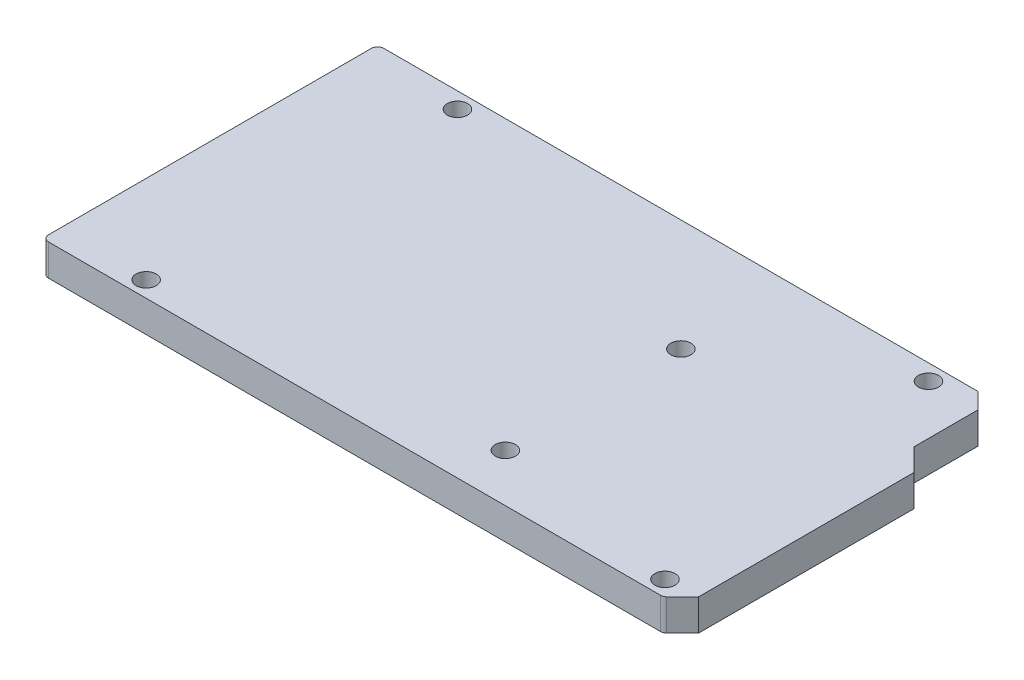
from build123d import *

# Parameters (mm, degrees)
BOSS_EXTRUDE1_DEPTH = 5
SKETCH2_R           = 1.608
CUT_EXTRUDE1_DEPTH  = 58.548241502
FILLET1_R           = 0.994


with BuildPart() as part:
    # Sketch1 → Boss-Extrude1 (new body)
    with BuildSketch(Plane(origin=(0, 0, 0), x_dir=(1, 0, 0), z_dir=(0, 1, 0))):
        Polygon((-50.76, -26.65), (-50.76, 26.65), (44.689, 26.65), (47.228, 24.111), (47.228, 13.955), (50.76, 10.423), (50.76, -23.834), (48.221, -26.373), (48.221, -26.65), align=None)
    extrude(amount=BOSS_EXTRUDE1_DEPTH)

    # Sketch2 → Cut-Extrude1 (cut, through all)
    with BuildSketch(Plane(origin=(0, 0, 0), x_dir=(1, 0, 0), z_dir=(0, 1, 0))):
        with Locations(Location((-35.525, 24.111, 0), (0, 0, 270))):
            Circle(SKETCH2_R)
        with Locations(Location((-36.795, -24.111, 0), (0, 0, 270))):
            Circle(SKETCH2_R)
        with Locations(Location((15.235, 8.876, 0), (0, 0, 270))):
            Circle(SKETCH2_R)
        with Locations(Location((15.235, -19.033, 0), (0, 0, 270))):
            Circle(SKETCH2_R)
        with Locations(Location((39.357, 24.111, 0), (0, 0, 270))):
            Circle(SKETCH2_R)
        with Locations(Location((45.684, -24.111, 0), (0, 0, 270))):
            Circle(SKETCH2_R)
    extrude(amount=CUT_EXTRUDE1_DEPTH, mode=Mode.SUBTRACT)

    # Fillet1
    # the kernel refuses this fillet: 0.994 mm, written as the material it takes off along each edge
    with BuildSketch(Plane(origin=(48.221, -1.721095218, 26.65), x_dir=(-1, 0, 0), z_dir=(0, 1, 0))) as fillet1_piece_1:
        with BuildLine():
            CenterArc((0.688438087, -0.994), FILLET1_R, 90, 43.83577097)
            Line((0, -0.277), (-0.013768762, -0.26266))
            ThreePointArc((-0.013768762, -0.26266), (-0.01988, -0.1385), (-0.01988, 0))
            Line((-0.01988, 0), (0, 0.01988))
            Line((0, 0.01988), (0.688438087, 0.01988))
            Line((0.688438087, 0.01988), (0.688438087, 0))
        make_face()
    extrude(amount=8.442190436, mode=Mode.SUBTRACT)
    with BuildSketch(Plane(origin=(-50.76, -2.485, 26.65), x_dir=(0, 0, -1), z_dir=(0, 1, 0))) as fillet1_piece_2:
        with BuildLine():
            CenterArc((FILLET1_R, -FILLET1_R), FILLET1_R, 90, 90)
            Line((0, -FILLET1_R), (-FILLET1_R * 0.02, -FILLET1_R))
            Line((-FILLET1_R * 0.02, -FILLET1_R), (-FILLET1_R * 0.02, FILLET1_R * 0.02))
            Line((-FILLET1_R * 0.02, FILLET1_R * 0.02), (FILLET1_R, FILLET1_R * 0.02))
            Line((FILLET1_R, FILLET1_R * 0.02), (FILLET1_R, 0))
        make_face()
    extrude(amount=9.97, mode=Mode.SUBTRACT)
    with BuildSketch(Plane(origin=(-50.76, -2.485, -26.65), x_dir=(0, 0, 1), z_dir=(0, 1, 0))) as fillet1_piece_3:
        with BuildLine():
            CenterArc((FILLET1_R, FILLET1_R), FILLET1_R, 180, 90)
            Line((0, FILLET1_R), (-FILLET1_R * 0.02, FILLET1_R))
            Line((-FILLET1_R * 0.02, FILLET1_R), (-FILLET1_R * 0.02, -FILLET1_R * 0.02))
            Line((-FILLET1_R * 0.02, -FILLET1_R * 0.02), (FILLET1_R, -FILLET1_R * 0.02))
            Line((FILLET1_R, -FILLET1_R * 0.02), (FILLET1_R, 0))
        make_face()
    extrude(amount=9.97, mode=Mode.SUBTRACT)


solid = part.part
